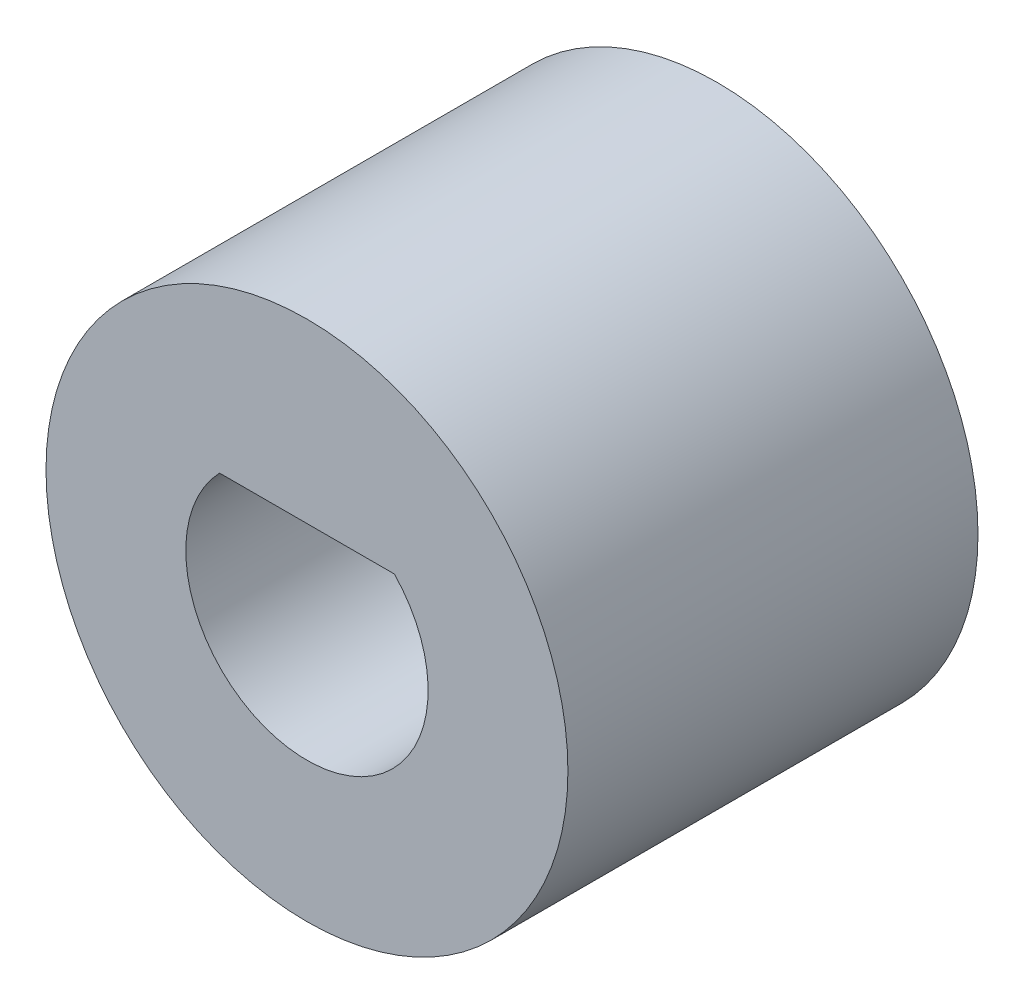
from build123d import *

# Parameters (mm, degrees)
ESQUISSE1_R        = 7
BOSS_EXTRU_1_DEPTH = 11


with BuildPart() as part:
    # Esquisse1 → Boss.-Extru.1 (new body)
    with BuildSketch(Plane.XY):
        Circle(ESQUISSE1_R)
        with BuildLine():
            Line((-2.34520788, 2.25), (2.34520788, 2.25))
            ThreePointArc((2.34520788, 2.25), (0, -3.25), (-2.34520788, 2.25))
        make_face(mode=Mode.SUBTRACT)
    extrude(amount=BOSS_EXTRU_1_DEPTH)


solid = part.part
